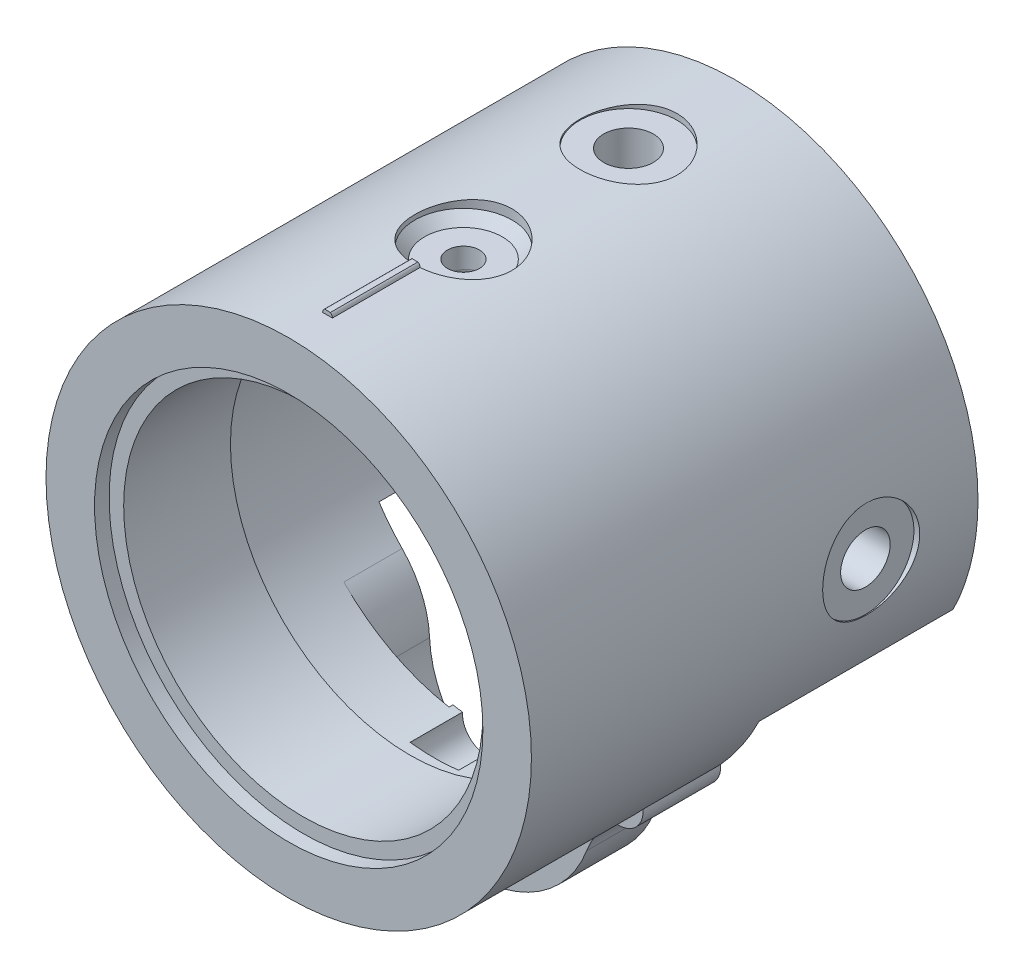
from build123d import *
from build123d.topology import SkipClean

# Parameters (mm, degrees)
SKETCH_1_R               = 25
SKETCH_1_R_2             = 18.5
EXTRUDE_1_DEPTH          = 11
SKETCH_2_R               = 25
SKETCH_2_R_2             = 20
EXTRUDE_2_DEPTH          = 1.5
EXTRUDE_START            = 1.5
SKETCH_3_R               = 25
SKETCH_3_R_2             = 20
EXTRUDE_3_DEPTH          = 1.5
SKETCH_4_R               = 0.5
EXTRUDE_4_DEPTH          = 10
EXTRUDE_START_2          = 4
SKETCH_6_R               = 22
EXTRUDE_5_DEPTH          = 4
SKETCH_7_R               = 2
CUT_EXTRUDE_1_DEPTH      = 4
F_1_ENCODERHOLDER_2_R    = 22
F_1_ENCODERHOLDER_2_R_2  = 18.5
F_1_ENCODERHOLDER_DEPTH  = 4
F_2_ENCODERHOLDER_START  = -4
F_2_ENCODERHOLDER_2_R    = 2
F_2_ENCODERHOLDER_DEPTH  = 4
F_3_ENCODERHOLDER_2_R    = 25
F_3_ENCODERHOLDER_2_R_2  = 18.5
F_3_ENCODERHOLDER_DEPTH  = 4
F_8_ENCODERHOLDER_R      = 2.5
CUT_EXTRUDE_6_DEPTH      = 10
SKETCH_9_R               = 12.5
CUT_EXTRUDE_7_DEPTH      = 2
F_5_ENCODERHOLDER_DEPTH  = 4
EXTRUDE_1_2_DEPTH        = 0.4
FILLET_1_R               = 1
SKETCH_12_R              = 0.9
CUT_EXTRUDE_8_DEPTH      = 10
EXTRUDE_2_2_DEPTH        = 6
FILLET_2_R               = 1
FILLET_START             = -1
FILLET_3_DEPTH           = 5
FILLET_START_2           = 0.675968
FILLET_3_2_DEPTH         = 5.324032
CUT_EXTRUDE_9_DEPTH      = 10
MOVE_BODY_2_ANGLE        = 180
SKETCH_15_R              = 20
CUT_EXTRUDE_10_DEPTH     = 79
EXTRUDE_12_DEPTH         = 4
CUT_EXTRUDE_11_DEPTH     = 3
EXTRUDE_13_DEPTH         = 10
EXTRUDE_14_DEPTH         = 1
SKETCH_22_R              = 1
CUT_EXTRUDE_12_DEPTH     = 8
SKETCH_23_R              = 2.5
SKETCH_23_R_2            = 1
EXTRUDE_16_DEPTH         = 8
SKETCH_24_W              = 1.265565874
SKETCH_24_H              = 0.2
CUT_EXTRUDE_13_DEPTH     = 25
EXTRUDE_5_2_DEPTH        = 6
FILLET_4_R               = 10
FILLET_5_R               = 10
FILLET_6_R               = 10
FILLET_7_R               = 10
SKETCH_26_R              = 1.65
CUT_EXTRUDE_14_DEPTH     = 36
SKETCH_27_R              = 5
CUT_EXTRUDE_15_DEPTH     = 2.4
FILLET_8_R               = 1
CHAMFER_2_SIZE           = 1
EXTRUDE_18_DEPTH         = 20
SKETCH_29_R              = 2.55
CUT_EXTRUDE_16_DEPTH     = 67
SKETCH_30_R              = 5
CUT_EXTRUDE_17_DEPTH     = 1
PATTERN_CIRCULAR_1_COUNT = 4


with BuildPart() as part:
    # 草图1 → Extrude 1 (new body)
    with BuildSketch(Plane.XY):
        Circle(SKETCH_1_R)
        Circle(SKETCH_1_R_2, mode=Mode.SUBTRACT)
    extrude(amount=EXTRUDE_1_DEPTH)

    # 草图2 → Extrude 2 (add)
    with BuildSketch(Plane.XY.offset(11)):
        Circle(SKETCH_2_R)
        Circle(SKETCH_2_R_2, mode=Mode.SUBTRACT)
    extrude(amount=EXTRUDE_2_DEPTH)

    # 草图3 → 凸台-拉伸3 (add)
    with BuildSketch(Plane(origin=(0, 0, 0), x_dir=(-1, 0, 0), z_dir=(0, 0, -1)).offset(EXTRUDE_START)):
        Circle(SKETCH_3_R)
        with Locations(Location((0, 0, 0), (0, 0, 180))):
            Circle(SKETCH_3_R_2, mode=Mode.SUBTRACT)
    extrude(amount=-EXTRUDE_3_DEPTH)

    # 草图4 → 凸台-拉伸4 (add)
    with SkipClean():  # the faces are left unmerged after this step: merging them gives an invalid solid
        with BuildSketch(Plane(origin=(0, 0, -1.5), x_dir=(-1, 0, 0), z_dir=(0, 0, -1))):
            with Locations((0, 25)):
                Circle(SKETCH_4_R)
        extrude(amount=-EXTRUDE_4_DEPTH)

    # 草图6 → Extrude 5 (add)
    with SkipClean():  # the faces are left unmerged after this step: merging them gives an invalid solid
        with BuildSketch(Plane(origin=(0, 0, -1.5), x_dir=(-1, 0, 0), z_dir=(0, 0, -1)).offset(EXTRUDE_START_2)):
            with BuildLine():
                ThreePointArc((-0.499974999, 24.995), (0, -25), (0.499974999, 24.995))
                ThreePointArc((0.499974999, 24.995), (0, 25.5), (-0.499974999, 24.995))
            make_face()
            Circle(SKETCH_6_R, mode=Mode.SUBTRACT)
        extrude(amount=-EXTRUDE_5_DEPTH)

    # 草图7 → 切除-拉伸1 (cut)
    with SkipClean():  # the faces are left unmerged after this step: merging them gives an invalid solid
        with BuildSketch(Plane(origin=(0, 0, -5.5), x_dir=(-1, 0, 0), z_dir=(0, 0, -1))):
            with Locations((0, 22)):
                Circle(SKETCH_7_R)
        extrude(amount=-CUT_EXTRUDE_1_DEPTH, mode=Mode.SUBTRACT)


with BuildPart() as body_2:
    # 1_EncoderHolder 2 → 1_EncoderHolder (new body)
    with BuildSketch(Plane.XY):
        Circle(F_1_ENCODERHOLDER_2_R)
        Circle(F_1_ENCODERHOLDER_2_R_2, mode=Mode.SUBTRACT)
    extrude(amount=F_1_ENCODERHOLDER_DEPTH)

    # 2_EncoderHolder 2 → 2_EncoderHolder (add)
    with BuildSketch(Plane.XY.offset(4).offset(F_2_ENCODERHOLDER_START)):
        with Locations((0, 22)):
            Circle(F_2_ENCODERHOLDER_2_R)
    extrude(amount=F_2_ENCODERHOLDER_DEPTH)

    # 3_EncoderHolder 2 → 3_EncoderHolder (add)
    with BuildSketch(Plane.XY.offset(4)):
        with Locations(Location((0, 0, 0), (0, 0, 91.14593469))):
            Circle(F_3_ENCODERHOLDER_2_R)
        Circle(F_3_ENCODERHOLDER_2_R_2, mode=Mode.SUBTRACT)
    extrude(amount=F_3_ENCODERHOLDER_DEPTH)

    # 草图8_EncoderHolder → 切除-拉伸6 (cut)
    with BuildSketch(Plane(origin=(0, 0, 0), x_dir=(-1, 0, 0), z_dir=(0, 0, -1))):
        with Locations((0, -20)):
            Circle(F_8_ENCODERHOLDER_R)
    extrude(amount=-CUT_EXTRUDE_6_DEPTH, mode=Mode.SUBTRACT)

    # 草图9 → 切除-拉伸7 (cut)
    with BuildSketch(Plane.XY.offset(8)):
        with Locations((0, -20)):
            Circle(SKETCH_9_R)
    extrude(amount=-CUT_EXTRUDE_7_DEPTH, mode=Mode.SUBTRACT)

    # 草图10 → 5_EncoderHolder (add)
    with BuildSketch(Plane.XY.offset(8)):
        with BuildLine():
            ThreePointArc((-11.297234175, -14.65), (-12.35555427, -18.105196926), (-12.381272085, -21.71875))
            ThreePointArc((-12.381272085, -21.71875), (0, 25), (12.381272085, -21.71875))
            ThreePointArc((12.381272085, -21.71875), (12.35555427, -18.105196926), (11.297234175, -14.65))
            ThreePointArc((11.297234175, -14.65), (0, 18.5), (-11.297234175, -14.65))
        make_face()
    extrude(amount=F_5_ENCODERHOLDER_DEPTH)

    # 草图11 → Extrude 1 2 (add)
    with BuildSketch(Plane.XY.offset(6)):
        with BuildLine():
            ThreePointArc((-1.920937271, -18.4), (0, -22.5), (1.920937271, -18.4))
            Line((1.920937271, -18.4), (2.68931218, -17.76))
            ThreePointArc((2.68931218, -17.76), (0, -23.5), (-2.68931218, -17.76))
            Line((-2.68931218, -17.76), (-1.920937271, -18.4))
        make_face()
    extrude(amount=EXTRUDE_1_2_DEPTH)

    # 圆角1
    # the kernel refuses this fillet: 1 mm, written as the material it takes off along each edge
    with BuildSketch(Plane(origin=(2.68931218, -17.76, 6), x_dir=(-0.7683749084931953, -0.6399999999984951, 0), z_dir=(0, 0, 1))) as fillet_1_piece_1:
        with BuildLine():
            CenterArc((1.2, 0.979795897), FILLET_1_R, 156.926081935, 101.536959033)
            Line((0.28, 1.371714256), (0.2616, 1.379552623))
            ThreePointArc((0.2616, 1.379552623), (0.051118442, 0.704), (-0.02, 0))
            Line((-0.02, 0), (0, -0.02))
            ThreePointArc((0, -0.02), (0.5, -0.02), (0.996, -0.019595918))
            Line((0.996, -0.019595918), (1, 0))
        make_face()
    extrude(amount=3.9, mode=Mode.SUBTRACT)
    with BuildSketch(Plane(origin=(-2.68931218, -17.76, 6), x_dir=(0.7683749084932087, -0.6399999999984791, 0), z_dir=(0, 0, 1))) as fillet_1_piece_2:
        with BuildLine():
            CenterArc((1.2, -0.979795897), FILLET_1_R, 101.536959033, 101.536959033)
            Line((0.28, -1.371714256), (0.2616, -1.379552623))
            ThreePointArc((0.2616, -1.379552623), (0.051118442, -0.704), (-0.02, 0))
            Line((-0.02, 0), (0, 0.02))
            ThreePointArc((0, 0.02), (0.5, 0.02), (0.996, 0.019595918))
            Line((0.996, 0.019595918), (1, 0))
        make_face()
    extrude(amount=3.9, mode=Mode.SUBTRACT)

    # 草图12 → 切除-拉伸8 (cut)
    with BuildSketch(Plane.XY.offset(12)):
        with Locations((-17.320508076, -10)):
            Circle(SKETCH_12_R)
        with Locations((17.320508076, -10)):
            Circle(SKETCH_12_R)
    extrude(amount=-CUT_EXTRUDE_8_DEPTH, mode=Mode.SUBTRACT)

    # 草图13 → Extrude 2 2 (add)
    with BuildSketch(Plane(origin=(0, 0, 0), x_dir=(-1, 0, 0), z_dir=(0, 0, -1))):
        Polygon((0, 18.5), (-7.664854858, 8), (-8.472547166, 8.58960422), (-0.807692308, 19.08960422), align=None)
    extrude(amount=-EXTRUDE_2_2_DEPTH)

    # 圆角2
    fillet_2_edges = [body_2.edges().sort_by_distance(p)[0] for p in [
        (1.269951879, 18.45635994, 3),
    ]]
    fillet(fillet_2_edges, radius=FILLET_2_R)

    # 圆角3: read off the stored shape, not the designer's step
    # 圆角3 outline → 圆角3 (cut)
    with BuildSketch(Plane.XY.offset(FILLET_START)):
        with BuildLine():
            ThreePointArc((-3.232609366, -18.215384615), (-2.572131012, -18.65007493), (-2.433817862, -19.428571429))
            ThreePointArc((-2.433817862, -19.428571429), (-2.237289178, -18.884411754), (-1.920937271, -18.4))
            ThreePointArc((-1.920937271, -18.4), (-2.578426157, -18.319435541), (-3.232609366, -18.215384615))
        make_face()
        with BuildLine():
            ThreePointArc((-1.572207346, -21.94375), (-2.132936973, -21.304062832), (-2.446717755, -20.513392857))
            ThreePointArc((-2.446717755, -20.513392857), (-2.703266107, -21.410498238), (-3.588519374, -21.705357143))
            ThreePointArc((-3.588519374, -21.705357143), (-2.583114953, -21.847826371), (-1.572207346, -21.94375))
        make_face()
        with BuildLine():
            ThreePointArc((2.433817862, -19.428571429), (2.572131012, -18.65007493), (3.232609366, -18.215384615))
            ThreePointArc((3.232609366, -18.215384615), (2.578426157, -18.319435541), (1.920937271, -18.4))
            ThreePointArc((1.920937271, -18.4), (2.237289178, -18.884411754), (2.433817862, -19.428571429))
        make_face()
        with BuildLine():
            ThreePointArc((2.446717755, -20.513392857), (2.132936973, -21.304062832), (1.572207346, -21.94375))
            ThreePointArc((1.572207346, -21.94375), (2.583114953, -21.847826371), (3.588519374, -21.705357143))
            ThreePointArc((3.588519374, -21.705357143), (2.703266107, -21.410498238), (2.446717755, -20.513392857))
        make_face()
    extrude(amount=FILLET_3_DEPTH, mode=Mode.SUBTRACT)

    # Fillet 3 2 outline → Fillet 3 2 (cut)
    with BuildSketch(Plane.XY.offset(FILLET_START_2)):
        with BuildLine():
            ThreePointArc((-3.232609366, -18.215384615), (-2.572131012, -18.65007493), (-2.433817862, -19.428571429))
            ThreePointArc((-2.433817862, -19.428571429), (-2.237289178, -18.884411754), (-1.920937271, -18.4))
            ThreePointArc((-1.920937271, -18.4), (-2.578426157, -18.319435541), (-3.232609366, -18.215384615))
        make_face()
        with BuildLine():
            ThreePointArc((2.433817862, -19.428571429), (2.572131012, -18.65007493), (3.232609366, -18.215384615))
            ThreePointArc((3.232609366, -18.215384615), (2.578426157, -18.319435541), (1.920937271, -18.4))
            ThreePointArc((1.920937271, -18.4), (2.237289178, -18.884411754), (2.433817862, -19.428571429))
        make_face()
    extrude(amount=FILLET_3_2_DEPTH, mode=Mode.SUBTRACT)

    # 草图14 → 切除-拉伸9 (cut)
    with BuildSketch(Plane(origin=(0, 0, 6), x_dir=(-1, 0, 0), z_dir=(0, 0, -1))):
        with BuildLine():
            ThreePointArc((-1.920937271, -18.4), (-2.374439978, -18.281048442), (-2.832315159, -18.38186757))
            ThreePointArc((-2.832315159, -18.38186757), (-2.472783917, -18.844197291), (-2.433817862, -19.428571429))
            ThreePointArc((-2.433817862, -19.428571429), (-2.237289178, -18.884411754), (-1.920937271, -18.4))
        make_face()
        with BuildLine():
            ThreePointArc((2.832315159, -18.38186757), (2.374439978, -18.281048442), (1.920937271, -18.4))
            ThreePointArc((1.920937271, -18.4), (2.237289178, -18.884411754), (2.433817862, -19.428571429))
            ThreePointArc((2.433817862, -19.428571429), (2.472783917, -18.844197291), (2.832315159, -18.38186757))
        make_face()
    extrude(amount=-CUT_EXTRUDE_9_DEPTH, mode=Mode.SUBTRACT)


with BuildPart() as body_2_1:
    # Move Body 1: moved
    add(body_2.part.moved(Location((-19.686751507, 39.513113702, 20.464284415))))


with BuildPart() as body_2_2:
    # Move Body 2: read off the stored shape, not the designer's step
    # Move Body 2: moved
    add(body_2_1.part.moved(Location((19.6867515, -39.5131137, -18.9642844))).rotate(Axis((0, 0, 0), (0, 1, 0)), MOVE_BODY_2_ANGLE))

    # Combine 1: union part
    add(part.part)

    # 草图15 → 切除-拉伸10 (cut)
    with BuildSketch(Plane(origin=(0, 0, 0), x_dir=(-1, 0, 0), z_dir=(0, 0, -1))):
        with Locations(Location((0, 0, 0), (0, 0, 180))):
            Circle(SKETCH_15_R)
    extrude(amount=CUT_EXTRUDE_10_DEPTH, mode=Mode.SUBTRACT)

    # 草图16 → 凸台-拉伸12 (add)
    with BuildSketch(Plane(origin=(0, 0, -1.5), x_dir=(-1, 0, 0), z_dir=(0, 0, -1))):
        with BuildLine():
            ThreePointArc((-2.49511241, -19.84375), (-2.493496889, -20.180203401), (-2.446717755, -20.513392857))
            ThreePointArc((-2.446717755, -20.513392857), (-2.703266107, -21.410498238), (-3.588519374, -21.705357143))
            ThreePointArc((-3.588519374, -21.705357143), (0, -22), (3.588519374, -21.705357143))
            ThreePointArc((3.588519374, -21.705357143), (2.703266107, -21.410498238), (2.446717755, -20.513392857))
            ThreePointArc((2.446717755, -20.513392857), (2.493496889, -20.180203401), (2.49511241, -19.84375))
            ThreePointArc((2.49511241, -19.84375), (0, -20), (-2.49511241, -19.84375))
        make_face()
    extrude(amount=EXTRUDE_12_DEPTH)

    # 草图17 → 切除-拉伸11 (cut)
    with BuildSketch(Plane(origin=(0, 0, -5.5), x_dir=(-1, 0, 0), z_dir=(0, 0, -1))):
        with BuildLine():
            ThreePointArc((-2.49511241, -19.84375), (0, -22.5), (2.49511241, -19.84375))
            ThreePointArc((2.49511241, -19.84375), (0, -20), (-2.49511241, -19.84375))
        make_face()
    extrude(amount=-CUT_EXTRUDE_11_DEPTH, mode=Mode.SUBTRACT)

    # 草图19 → 凸台-拉伸13 (add)
    with BuildSketch(Plane(origin=(0, 0, -3.5), x_dir=(-1, 0, 0), z_dir=(0, 0, -1))):
        with BuildLine():
            ThreePointArc((16.853084982, -10.769100547), (18.099930939, -10.45), (17.752857141, -9.210649453))
            ThreePointArc((17.752857141, -9.210649453), (17.320508076, -10), (16.853084982, -10.769100547))
        make_face()
        with BuildLine():
            ThreePointArc((-17.752857141, -9.210649453), (-18.099930939, -10.45), (-16.853084982, -10.769100547))
            ThreePointArc((-16.853084982, -10.769100547), (-17.320508076, -10), (-17.752857141, -9.210649453))
        make_face()
    extrude(amount=EXTRUDE_13_DEPTH)

    # 草图20 → 凸台-拉伸14 (add)
    with BuildSketch(Plane(origin=(0, 0, -7.5), x_dir=(-1, 0, 0), z_dir=(0, 0, -1))):
        with BuildLine():
            ThreePointArc((-12.381272085, -21.71875), (0, -32.5), (12.381272085, -21.71875))
            ThreePointArc((12.381272085, -21.71875), (0, -25), (-12.381272085, -21.71875))
        make_face()
    extrude(amount=-EXTRUDE_14_DEPTH)

    # 草图22 → 切除-拉伸12 (cut)
    with BuildSketch(Plane(origin=(0, 0, -13.5), x_dir=(-1, 0, 0), z_dir=(0, 0, -1))):
        with Locations((-16, -17)):
            Circle(SKETCH_22_R)
    cut_extrude_12 = extrude(amount=-CUT_EXTRUDE_12_DEPTH, mode=Mode.SUBTRACT)

    # 草图23 → 凸台-拉伸16 (add)
    with BuildSketch(Plane(origin=(0, 0, -13.5), x_dir=(-1, 0, 0), z_dir=(0, 0, -1))):
        with Locations((-16, -17)):
            Circle(SKETCH_23_R)
        with Locations((-16, -17)):
            Circle(SKETCH_23_R_2, mode=Mode.SUBTRACT)
    extrude_16 = extrude(amount=-EXTRUDE_16_DEPTH)

    # 镜向2: 切除-拉伸12, 凸台-拉伸16 across plane
    add(cut_extrude_12.mirror(Plane(origin=(0, 0, 0), x_dir=(0, 0, 1), z_dir=(1, 0, 0))), mode=Mode.SUBTRACT)
    add(extrude_16.mirror(Plane(origin=(0, 0, 0), x_dir=(0, 0, 1), z_dir=(1, 0, 0))))

    # 草图24 → 切除-拉伸13 (cut)
    with BuildSketch(Plane(origin=(0, 0, -13.5), x_dir=(-1, 0, 0), z_dir=(0, 0, -1))):
        with Locations((0, 25.5)):
            Rectangle(SKETCH_24_W, SKETCH_24_H)
    extrude(amount=-CUT_EXTRUDE_13_DEPTH, mode=Mode.SUBTRACT)

    # 草图25 → Extrude 5 2 (add)
    with BuildSketch(Plane(origin=(0, 0, -7.5), x_dir=(-1, 0, 0), z_dir=(0, 0, -1))):
        with BuildLine():
            ThreePointArc((-11.873971995, -16.09375), (-12.449472784, -18.877223349), (-12.381272085, -21.71875))
            ThreePointArc((-12.381272085, -21.71875), (0, -32.5), (12.381272085, -21.71875))
            ThreePointArc((12.381272085, -21.71875), (12.449472784, -18.877223349), (11.873971995, -16.09375))
            Line((11.873971995, -16.09375), (10.924054235, -16.40625))
            ThreePointArc((10.924054235, -16.40625), (11.453514961, -18.967045481), (11.390770318, -21.58125))
            ThreePointArc((11.390770318, -21.58125), (0, -31.5), (-11.390770318, -21.58125))
            ThreePointArc((-11.390770318, -21.58125), (-11.453514961, -18.967045481), (-10.924054235, -16.40625))
            Line((-10.924054235, -16.40625), (-11.873971995, -16.09375))
        make_face()
    extrude(amount=EXTRUDE_5_2_DEPTH)

    # 圆角4
    # the kernel refuses this fillet: 10 mm, written as the material it takes off along each edge
    with BuildSketch(Plane(origin=(10.924054235, -16.40625, -7.5), x_dir=(0.9499177588002072, 0.312500002425586, 0), z_dir=(0, 0, -1))) as fillet_4_piece_1:
        with BuildLine():
            CenterArc((9.239999982, 5.665898025), FILLET_4_R, 195.279631881, 19.233131139)
            ThreePointArc((-0.406511638, 3.030596604), (-0.102080978, 1.528869475), (0, 0))
            Line((0, 0), (1.000000008, 0))
        make_face()
    extrude(amount=13.644347377, mode=Mode.SUBTRACT)
    with BuildSketch(Plane(origin=(-10.924054235, -16.40625, -7.5), x_dir=(-0.9499177602580843, 0.31249999799402367, 0), z_dir=(0, 0, -1))) as fillet_4_piece_2:
        with BuildLine():
            CenterArc((9.240000015, -5.665897956), FILLET_4_R, 145.487237464, 19.233130995)
            ThreePointArc((-0.40651162, -3.030596592), (-0.10208097, -1.528869468), (0, 0))
            Line((0, 0), (0.999999994, 0))
        make_face()
    extrude(amount=13.64434734, mode=Mode.SUBTRACT)

    # 圆角5
    # the kernel refuses this fillet: 10 mm, written as the material it takes off along each edge
    with BuildSketch(Plane(origin=(-11.87397199, -16.093750004, -24.569552782), x_dir=(-0.7538894395280353, 0.6570013036274012, 0), z_dir=(0, 0, 1))) as fillet_5_piece_1:
        with BuildLine():
            CenterArc((4.054881612, 9.967061623), FILLET_5_R, 223.587400745, 41.760938805)
            Line((-3.18835329, 3.072458796), (-3.912676781, 2.382998513))
            ThreePointArc((-3.912676781, 2.382998513), (-3.259922176, 1.628489204), (-0.539147437, -0.842211399))
            Line((-0.539147437, -0.842211399), (0.081097632, -0.996706162))
            ThreePointArc((0.081097632, -0.996706162), (1.621952645, -0.934123247), (3.162807657, -0.996706162))
            Line((3.162807657, -0.996706162), (3.243905289, 0))
        make_face()
    extrude(amount=17.069552767, mode=Mode.SUBTRACT)

    # 圆角6
    # the kernel refuses this fillet: 10 mm, written as the material it takes off along each edge
    with BuildSketch(Plane(origin=(11.873972002, -16.093749995, -7.500000015), x_dir=(0.7538894392828103, 0.6570013039087899, 0), z_dir=(0, 0, -1))) as fillet_6_piece_1:
        with BuildLine():
            CenterArc((4.054881593, 9.967061624), FILLET_6_R, 223.587400767, 41.760938805)
            Line((-3.188353306, 3.072458793), (-3.912676796, 2.38299851))
            ThreePointArc((-3.912676796, 2.38299851), (-3.2599222, 1.628489213), (-0.539147434, -0.842211401))
            Line((-0.539147434, -0.842211401), (0.081097632, -0.996706162))
            ThreePointArc((0.081097632, -0.996706162), (1.621952637, -0.934123247), (3.162807643, -0.996706162))
            Line((3.162807643, -0.996706162), (3.243905275, 0))
        make_face()
    extrude(amount=17.069552792, mode=Mode.SUBTRACT)

    # 圆角7
    fillet_7_edges = [body_2_2.edges().sort_by_distance(p)[0] for p in [
        (-12.381272077, -21.718749998, -10.500000015),
        (12.38127209, -21.718749998, -10.500000011),
    ]]
    fillet(fillet_7_edges, radius=FILLET_7_R)

    # 草图26 → 切除-拉伸14 (cut)
    with BuildSketch(Plane(origin=(0, 0, 0), x_dir=(1, 0, 0), z_dir=(0, 1, 0))):
        with Locations(Location((0, 5.5, 0), (0, 0, 90))):
            Circle(SKETCH_26_R)
    extrude(amount=CUT_EXTRUDE_14_DEPTH, mode=Mode.SUBTRACT)

    # 草图27 → 切除-拉伸15 (cut)
    with BuildSketch(Plane(origin=(0, 25.4, 0), x_dir=(1, 0, 0), z_dir=(0, 1, 0))):
        with Locations(Location((0, 5.5, 0), (0, 0, 270))):
            Circle(SKETCH_27_R)
    extrude(amount=-CUT_EXTRUDE_15_DEPTH, mode=Mode.SUBTRACT)

    # 圆角8
    fillet_8_edges = [body_2_2.edges().sort_by_distance(p)[0] for p in [
        (-6e-09, 20.000000028, -3.84999999),
    ]]
    fillet(fillet_8_edges, radius=FILLET_8_R)

    # 倒角2
    chamfer_2_edges = [body_2_2.edges().sort_by_distance(p)[0] for p in [
        (0, 23, -10.5),
    ]]
    chamfer(chamfer_2_edges, length=CHAMFER_2_SIZE)

    # 草图28 → 凸台-拉伸18 (add)
    with BuildSketch(Plane(origin=(0, 0, -13.5), x_dir=(-1, 0, 0), z_dir=(0, 0, -1))):
        with BuildLine():
            Line((-22.449944321, -11), (-16.703293088, -11))
            ThreePointArc((-16.703293088, -11), (0, 20), (16.703293088, -11))
            Line((16.703293088, -11), (22.449944321, -11))
            ThreePointArc((22.449944321, -11), (0, 25), (-22.449944321, -11))
        make_face()
    extrude(amount=EXTRUDE_18_DEPTH)

    # 草图29 → 切除-拉伸16 (cut)
    with BuildSketch(Plane(origin=(0, 0, 0), x_dir=(1, 0, 0), z_dir=(0, 1, 0))):
        with Locations(Location((0, 22.5, 0), (0, 0, 90))):
            Circle(SKETCH_29_R)
    cut_extrude_16 = extrude(amount=CUT_EXTRUDE_16_DEPTH, mode=Mode.SUBTRACT)

    # 草图30 → 切除-拉伸17 (cut)
    with BuildSketch(Plane(origin=(0, 25.4, 0), x_dir=(1, 0, 0), z_dir=(0, 1, 0))):
        with Locations(Location((0, 22.5, 0), (0, 0, 270))):
            Circle(SKETCH_30_R)
    cut_extrude_17 = extrude(amount=-CUT_EXTRUDE_17_DEPTH, mode=Mode.SUBTRACT)

    # 阵列(圆周)1: 切除-拉伸16, 切除-拉伸17 ×4 about axis
    pattern_circular_1_axis = Axis((0, 0, 0), (0, 0, 1))
    add([cut_extrude_16.rotate(pattern_circular_1_axis, i * 360 / PATTERN_CIRCULAR_1_COUNT) for i in range(1, PATTERN_CIRCULAR_1_COUNT)], mode=Mode.SUBTRACT)
    add([cut_extrude_17.rotate(pattern_circular_1_axis, i * 360 / PATTERN_CIRCULAR_1_COUNT) for i in range(1, PATTERN_CIRCULAR_1_COUNT)], mode=Mode.SUBTRACT)


solid = body_2_2.part
